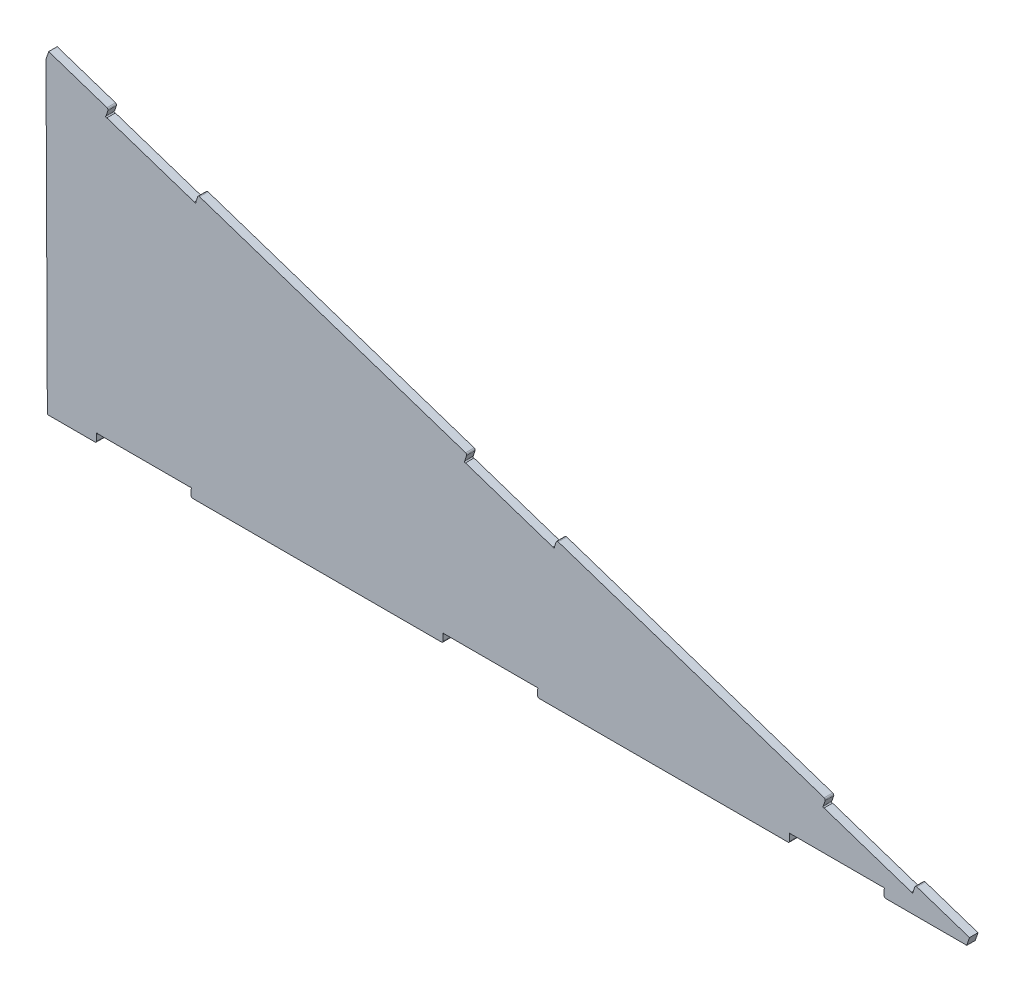
from build123d import *

# Parameters (mm, degrees)
BOSS_EXTRUDE1_DEPTH = 2.7
CAVITY1_OUTLINE_W   = 30
CAVITY1_OUTLINE_H   = 2.7
CAVITY1_DEPTH       = 2.7
CAVITY2_START       = -11.622776602
CAVITY2_OUTLINE_W   = 1.798654648
CAVITY2_OUTLINE_H   = 2.7
CAVITY2_DEPTH       = 30
CAVITY2_START_2     = 108.377223398
CAVITY2_2_OUTLINE_W = 1.798654648
CAVITY2_2_OUTLINE_H = 2.7
CAVITY2_2_DEPTH     = 30
CAVITY2_START_3     = 228.377223398
CAVITY2_3_OUTLINE_W = 1.798654648
CAVITY2_3_OUTLINE_H = 2.7
CAVITY2_3_DEPTH     = 30
CUT_EXTRUDE1_DEPTH  = 317.239292309
BOSS_EXTRUDE3_DEPTH = 2.7
SKETCH7_R           = 0.25
CUT_EXTRUDE2_DEPTH  = 2.7
FILLET2_R           = 0.5


# Read off the part's stored shape, not the designer's step: Cavity1, Cavity2
with BuildPart() as part:
    # Sketch1 → Boss-Extrude1 (new body)
    with BuildSketch(Plane.XY):
        Polygon((0, 0), (300, 0), (0, 100), align=None)
    extrude(amount=BOSS_EXTRUDE1_DEPTH)

    # Cavity1 outline → Cavity1 (cut)
    with BuildSketch(Plane.XY):
        with Locations((30.21166892, 1.35)):
            Rectangle(CAVITY1_OUTLINE_W, CAVITY1_OUTLINE_H)
        Polygon((47.149134475, 83.333520418), (47.434164903, 84.188611699), (18.973665961, 93.67544468), (18.688635534, 92.820353398), align=None)
        Polygon((160.991130241, 45.386188495), (161.276160669, 46.241279777), (132.815661727, 55.728112758), (132.5306313, 54.873021476), align=None)
        Polygon((274.833126007, 7.438856573), (275.118156435, 8.293947855), (246.657657493, 17.780780836), (246.372627066, 16.925689554), align=None)
        with Locations((250.21166892, 1.35)):
            Rectangle(CAVITY1_OUTLINE_W, CAVITY1_OUTLINE_H)
        with Locations((140.21166892, 1.35)):
            Rectangle(CAVITY1_OUTLINE_W, CAVITY1_OUTLINE_H)
    extrude(amount=CAVITY1_DEPTH, mode=Mode.SUBTRACT)

    # Cavity2 outline → Cavity2 (cut)
    with BuildSketch(Plane(origin=(0, 0, 0), x_dir=(0.316227766016832, 0.9486832980505158, 0), z_dir=(0.9486832980505159, -0.316227766016832, 0)).offset(CAVITY2_START)):
        with Locations((93.067657129, 1.35)):
            Rectangle(CAVITY2_OUTLINE_W, CAVITY2_OUTLINE_H)
    extrude(amount=CAVITY2_DEPTH, mode=Mode.SUBTRACT)

    # Cavity2 2 outline → Cavity2 2 (cut)
    with BuildSketch(Plane(origin=(0, 0, 0), x_dir=(0.316227766016832, 0.9486832980505158, 0), z_dir=(0.9486832980505159, -0.316227766016832, 0)).offset(CAVITY2_START_2)):
        with Locations((93.067657129, 1.35)):
            Rectangle(CAVITY2_2_OUTLINE_W, CAVITY2_2_OUTLINE_H)
    extrude(amount=CAVITY2_2_DEPTH, mode=Mode.SUBTRACT)

    # Cavity2 3 outline → Cavity2 3 (cut)
    with BuildSketch(Plane(origin=(0, 0, 0), x_dir=(0.316227766016832, 0.9486832980505158, 0), z_dir=(0.9486832980505159, -0.316227766016832, 0)).offset(CAVITY2_START_3)):
        with Locations((93.067657129, 1.35)):
            Rectangle(CAVITY2_3_OUTLINE_W, CAVITY2_3_OUTLINE_H)
    extrude(amount=CAVITY2_3_DEPTH, mode=Mode.SUBTRACT)

    # Sketch4 → Cut-Extrude1 (cut, through all)
    with BuildSketch(Plane.XY.offset(2.7)):
        Polygon((292.315665286, 2.561444905), (291.461850318, 0), (300, 0), align=None)
    extrude(amount=-CUT_EXTRUDE1_DEPTH, mode=Mode.SUBTRACT)

    # Sketch5 → Boss-Extrude3 (add)
    with BuildSketch(Plane.XY.offset(2.7)):
        Polygon((0, 100), (-0.853814968, 97.438555095), (-0.426907484, 0), (0, 0), align=None)
    extrude(amount=-BOSS_EXTRUDE3_DEPTH)

    # Sketch7 → Cut-Extrude2 (cut)
    with BuildSketch(Plane.XY.offset(2.7)):
        with Locations((18.343457791, 91.225803174)):
            Circle(SKETCH7_R)
        with Locations((132.185453557, 53.278471252)):
            Circle(SKETCH7_R)
        with Locations((46.468546535, 81.850773592)):
            Circle(SKETCH7_R)
        with Locations((160.310542301, 43.90344167)):
            Circle(SKETCH7_R)
        with Locations((246.027449323, 15.33113933)):
            Circle(SKETCH7_R)
        with Locations((274.152538068, 5.956109748)):
            Circle(SKETCH7_R)
        with Locations((265.034892224, 2.523223305)):
            Circle(SKETCH7_R)
        with Locations((235.388445615, 2.523223305)):
            Circle(SKETCH7_R)
        with Locations((155.034892224, 2.523223305)):
            Circle(SKETCH7_R)
        with Locations((125.388445615, 2.523223305)):
            Circle(SKETCH7_R)
        with Locations((45.034892224, 2.523223305)):
            Circle(SKETCH7_R)
        with Locations((15.388445615, 2.523223305)):
            Circle(SKETCH7_R)
    extrude(amount=-CUT_EXTRUDE2_DEPTH, mode=Mode.SUBTRACT)

    # Fillet2
    fillet2_edges = [part.edges().sort_by_distance(p)[0] for p in [
        (18.973665961, 93.67544468, 1.35),
        (47.434164903, 84.188611699, 1.35),
        (132.815661727, 55.728112758, 1.35),
        (161.276160669, 46.241279777, 1.35),
        (246.657657493, 17.780780836, 1.35),
        (275.118156435, 8.293947855, 1.35),
        (235.21166892, 0, 1.35),
        (125.21166892, 0, 1.35),
        (15.21166892, 0, 1.35),
        (265.21166892, 0, 1.35),
        (155.21166892, 0, 1.35),
        (45.21166892, 0, 1.35),
    ]]
    fillet(fillet2_edges, radius=FILLET2_R)


solid = part.part
